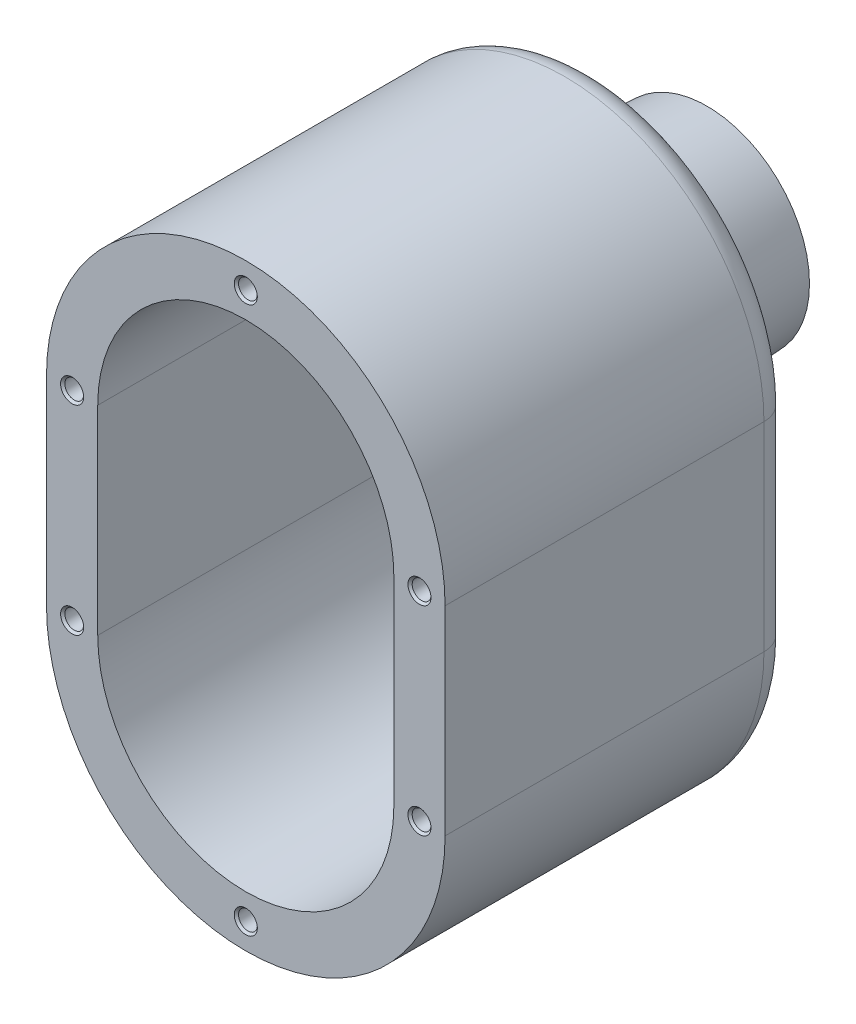
from build123d import *
from build123d.topology import SkipClean

# Parameters (mm, degrees)
BOSS_EXTRUDE3_DEPTH         = 29
SHELL9_T                    = -9
SKETCH6_R                   = 14
CUT_EXTRUDE1_DEPTH          = 15
SKETCH7_R                   = 10.5
CUT_EXTRUDE2_DEPTH          = 6
SKETCH8_R                   = 9
BOSS_EXTRUDE4_DEPTH         = 14.8
SKETCH9_R                   = 10.5
CUT_EXTRUDE3_DEPTH          = 5
SKETCH10_R                  = 11
CUT_EXTRUDE4_DEPTH          = 1.1
SKETCH11_R                  = 10.5
CUT_EXTRUDE5_DEPTH          = 77.923663459
CUT_EXTRUDE6_DEPTH          = 77.923663459
CUT_EXTRUDE6_DEPTH_BACK     = 77.923663459
SKETCH12_R                  = 6
BOSS_EXTRUDE6_START         = 3
BOSS_EXTRUDE6_DEPTH         = 3
SKETCH23_R                  = 7.5
SKETCH23_R_2                = 6
BOSS_EXTRUDE9_DEPTH         = 2
FILLET2_R                   = 5
M4_TAPPED_HOLE1_D           = 3.3
M4_TAPPED_HOLE1_DEPTH       = 13
M4_TAPPED_HOLE1_CSINK_D     = 4.05
M4_TAPPED_HOLE1_CSINK_ANGLE = 90
M4_TAPPED_HOLE1_TIP         = 0.991420021
SCALE1_SCALE                = 0.317565217


with BuildPart() as part:
    # Sketch2 → Boss-Extrude3 (new, symmetric)
    with BuildSketch(Plane.XY):
        with BuildLine():
            Line((-35, -17.5), (-35, 17.5))
            ThreePointArc((-35, 17.5), (0, 52.5), (35, 17.5))
            Line((35, 17.5), (35, -17.5))
            ThreePointArc((35, -17.5), (0, -52.5), (-35, -17.5))
        make_face()
    extrude(amount=BOSS_EXTRUDE3_DEPTH, both=True)

    # Shell9
    shell9_openings = [part.faces().sort_by_distance(p)[0] for p in [
        (0, 0, 29),
    ]]
    offset(amount=SHELL9_T, openings=shell9_openings, kind=Kind.INTERSECTION)

    # Sketch3 → Revolve1 (revolve)
    with BuildSketch(Plane(origin=(0, 0, 0), x_dir=(0, 0, -1), z_dir=(1, 0, 0))):
        Polygon((29, 17.5), (49, 17.5), (49, -0.5), (29, -1.764441806), align=None)
    revolve(axis=Axis((0, 17.5, -29), (0, 0, -1)))

    # Sketch4 → Revolve2 (revolve)
    with BuildSketch(Plane(origin=(0, 0, 0), x_dir=(0, 0, -1), z_dir=(1, 0, 0))):
        Polygon((20, 17.5), (20, 36.548902179), (5, 35.5), (5, 17.5), align=None)
    revolve(axis=Axis((0, 17.5, -5), (0, 0, -1)))

    # Sketch5 → Revolve4 (revolve)
    with BuildSketch(Plane(origin=(0, 0, 0), x_dir=(0, 0, -1), z_dir=(1, 0, 0))):
        Polygon((20, -17.5), (20, -6.95), (5, -8), (5, -17.5), align=None)
    revolve(axis=Axis((0, -17.5, -5), (0, 0, -1)))

    # Sketch6 → Cut-Extrude1 (cut)
    with BuildSketch(Plane(origin=(0, 0, -49), x_dir=(-1, 0, 0), z_dir=(0, 0, -1))):
        with Locations((0, 17.5)):
            Circle(SKETCH6_R)
    extrude(amount=-CUT_EXTRUDE1_DEPTH, mode=Mode.SUBTRACT)

    # Sketch7 → Cut-Extrude2 (cut)
    with BuildSketch(Plane(origin=(0, 0, -34), x_dir=(-1, 0, 0), z_dir=(0, 0, -1))):
        with Locations((0, 17.5)):
            Circle(SKETCH7_R)
    extrude(amount=-CUT_EXTRUDE2_DEPTH, mode=Mode.SUBTRACT)

    # Sketch8 → Boss-Extrude4 (add)
    with BuildSketch(Plane(origin=(0, 0, -28), x_dir=(-1, 0, 0), z_dir=(0, 0, -1))):
        with Locations((0, 17.5)):
            Circle(SKETCH8_R)
    extrude(amount=-BOSS_EXTRUDE4_DEPTH)

    # Sketch9 → Cut-Extrude3 (cut)
    with BuildSketch(Plane(origin=(0, 0, -28), x_dir=(-1, 0, 0), z_dir=(0, 0, -1))):
        with Locations((0, 17.5)):
            Circle(SKETCH9_R)
    extrude(amount=-CUT_EXTRUDE3_DEPTH, mode=Mode.SUBTRACT)

    # Sketch10 → Cut-Extrude4 (cut)
    with BuildSketch(Plane(origin=(0, 0, -23), x_dir=(-1, 0, 0), z_dir=(0, 0, -1))):
        with Locations((0, 17.5)):
            Circle(SKETCH10_R)
    extrude(amount=-CUT_EXTRUDE4_DEPTH, mode=Mode.SUBTRACT)

    # Sketch11 → Cut-Extrude5 (cut, through all)
    with BuildSketch(Plane.XY.offset(-5)):
        with Locations((0, 17.5)):
            Circle(SKETCH11_R)
    extrude(amount=-CUT_EXTRUDE5_DEPTH, mode=Mode.SUBTRACT)

    # Sketch12 → Cut-Extrude6 (cut, two sides: drawn at the far end of the back side and taken through both)
    with BuildSketch(Plane.XY.offset(-5).offset(-CUT_EXTRUDE6_DEPTH_BACK)):
        with Locations((0, -17.5)):
            Circle(SKETCH12_R)
    extrude(amount=CUT_EXTRUDE6_DEPTH + CUT_EXTRUDE6_DEPTH_BACK, mode=Mode.SUBTRACT)

    # Sketch15 → Boss-Extrude6 (add)
    with BuildSketch(Plane.XY.offset(29).offset(BOSS_EXTRUDE6_START)):
        with BuildLine():
            Line((35, -17.5), (35, 17.5))
            ThreePointArc((35, 17.5), (0, 52.5), (-35, 17.5))
            Line((-35, 17.5), (-35, -17.5))
            ThreePointArc((-35, -17.5), (0, -52.5), (35, -17.5))
        make_face()
        with BuildLine():
            Line((26, -17.5), (26, 17.5))
            ThreePointArc((26, 17.5), (0, 43.5), (-26, 17.5))
            Line((-26, 17.5), (-26, -17.5))
            ThreePointArc((-26, -17.5), (0, -43.5), (26, -17.5))
        make_face(mode=Mode.SUBTRACT)
    extrude(amount=-BOSS_EXTRUDE6_DEPTH)

    # Sketch23 → Boss-Extrude9 (add)
    with SkipClean():  # the faces are left unmerged after this step: merging them gives an invalid solid
        with BuildSketch(Plane(origin=(0, 0, -29), x_dir=(-1, 0, 0), z_dir=(0, 0, -1))):
            with Locations((0, -17.5)):
                Circle(SKETCH23_R)
            with Locations((0, -17.5)):
                Circle(SKETCH23_R_2, mode=Mode.SUBTRACT)
        extrude(amount=BOSS_EXTRUDE9_DEPTH)

    # Fillet2
    fillet2_edges = [part.edges().sort_by_distance(p)[0] for p in [
        (35, 0, -29),
        (-35, 0, -29),
        (0, 52.5, -29),
        (0, -52.5, -29),
    ]]
    fillet(fillet2_edges, radius=FILLET2_R)

    # M4 Tapped Hole1
    with Locations(Plane(origin=(0, 48, 32), x_dir=(1, 0, 0), z_dir=(0, 0, 1))):
        with Locations((0, 0), (30.5, -30.5), (30.5, -65.5), (0, -96), (-30.5, -65.5), (-30.5, -30.5)):
            CounterSinkHole(M4_TAPPED_HOLE1_D / 2, M4_TAPPED_HOLE1_CSINK_D / 2, depth=M4_TAPPED_HOLE1_DEPTH, counter_sink_angle=M4_TAPPED_HOLE1_CSINK_ANGLE)
            with Locations((0, 0, -(M4_TAPPED_HOLE1_DEPTH + M4_TAPPED_HOLE1_TIP / 2))):  # 118° drill point
                Cone(0, M4_TAPPED_HOLE1_D / 2, M4_TAPPED_HOLE1_TIP, mode=Mode.SUBTRACT)


with BuildPart() as part_1:
    # Scale1: scaled about (0, 1.462344078, -5.65357403)
    add(part.part.scale(SCALE1_SCALE).moved(Location((0, 0.997954463, -3.858195564))))


solid = part_1.part
